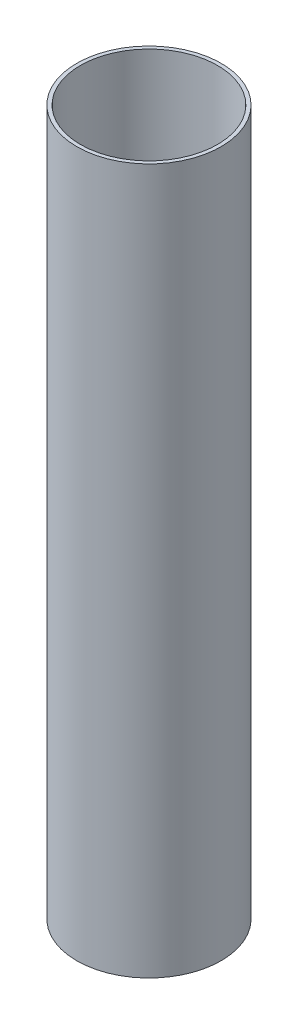
from build123d import *

# Parameters (mm, degrees)
SKETCH1_R           = 93.6625
SKETCH1_R_2         = 88.9
BOSS_EXTRUDE1_DEPTH = 457.2


with BuildPart() as part:
    # Sketch1 → Boss-Extrude1 (new, symmetric)
    with BuildSketch(Plane(origin=(0, 0, 0), x_dir=(1, 0, 0), z_dir=(0, 1, 0))):
        Circle(SKETCH1_R)
        Circle(SKETCH1_R_2, mode=Mode.SUBTRACT)
    extrude(amount=BOSS_EXTRUDE1_DEPTH, both=True)


solid = part.part
